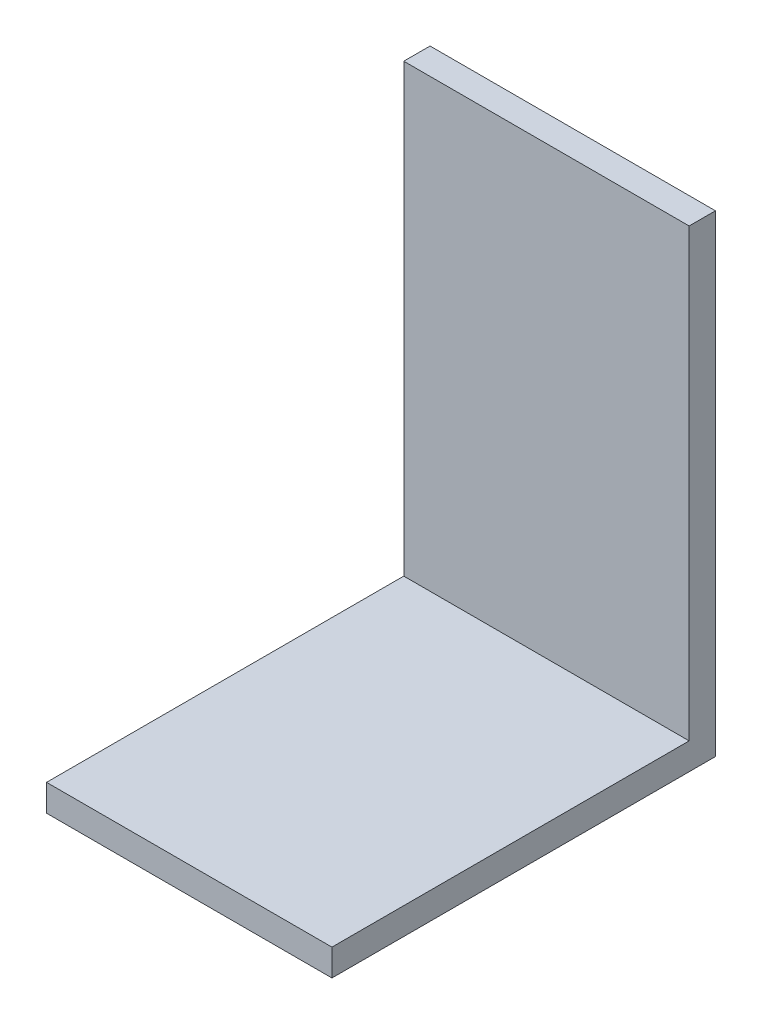
from build123d import *

# Parameters (mm, degrees)
SKETCH6_W           = 32
SKETCH6_H           = 43
BOSS_EXTRUDE6_DEPTH = 3
SKETCH10_W          = 32
SKETCH10_H          = 2.948826776
BOSS_EXTRUDE7_DEPTH = 50


with BuildPart() as part:
    # Sketch6 → Boss-Extrude6 (new body)
    with BuildSketch(Plane(origin=(0, 0, 0), x_dir=(1, 0, 0), z_dir=(0, 1, 0))):
        with Locations((16, 21.5)):
            Rectangle(SKETCH6_W, SKETCH6_H)
    extrude(amount=BOSS_EXTRUDE6_DEPTH)

    # Sketch10 → Boss-Extrude7 (add)
    with BuildSketch(Plane(origin=(0, 3, 0), x_dir=(1, 0, 0), z_dir=(0, 1, 0))):
        with Locations((16, 41.525586612)):
            Rectangle(SKETCH10_W, SKETCH10_H)
    extrude(amount=BOSS_EXTRUDE7_DEPTH)


solid = part.part
